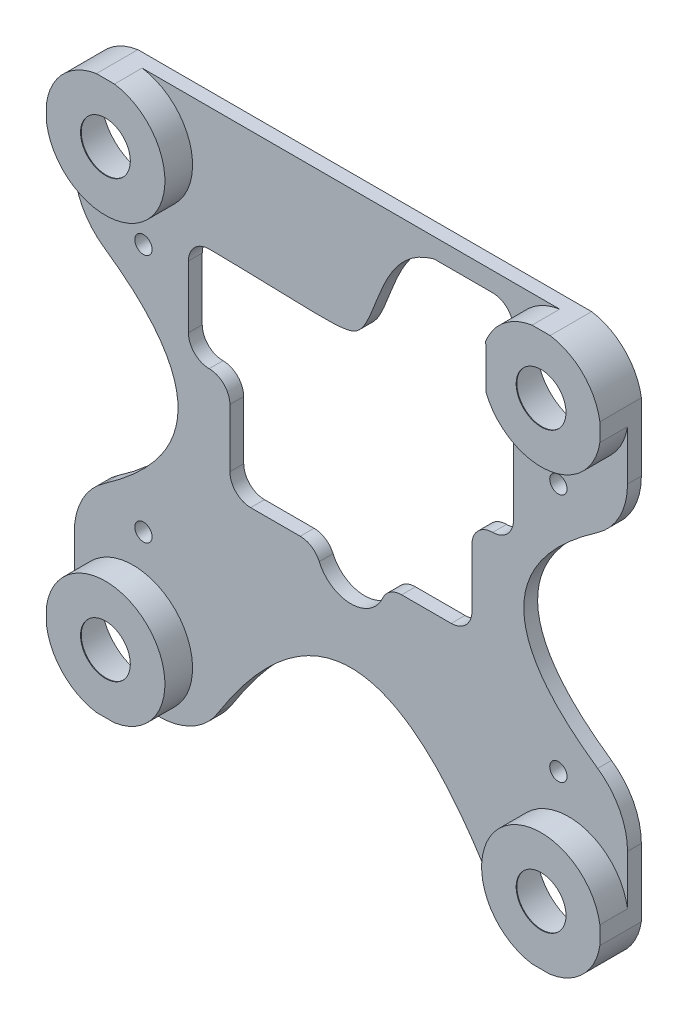
from build123d import *

# Parameters (mm, degrees)
SKETCH2_R           = 1.25
SKETCH2_R_2         = 1
BOSS_EXTRUDE1_DEPTH = 2
SKETCH2_6_R         = 3.6
BOSS_EXTRUDE2_DEPTH = 6
SKETCH2_7_R         = 6.6
SKETCH2_7_R_2       = 3.6
CUT_EXTRUDE1_DEPTH  = 5.9
FILLET1_START       = -1
FILLET1_DEPTH       = 7
FILLET1_2_DEPTH     = 2
FILLET1_START_2     = 1.81644
FILLET1_3_DEPTH     = 4.18356
FILLET2_START       = -1
FILLET2_DEPTH       = 7
FILLET3_R           = 1


with BuildPart() as part:
    # Sketch2 → Boss-Extrude1 (new body)
    # profile 1 of 9: a face of its own
    with BuildSketch(Plane.XY):
        with BuildLine():
            Line((55.869745962, 39.84949243), (43.365744361, 39.84949243))
            ThreePointArc((43.365744361, 39.84949243), (38.369745962, 35.04949243), (33.373747564, 39.84949243))
            Line((33.373747564, 39.84949243), (20.869745962, 39.84949243))
            Line((20.869745962, 39.84949243), (20.869745962, 54.24949243))
            Line((20.869745962, 54.24949243), (20.591198677, 54.24949243))
            ThreePointArc((20.591198677, 54.24949243), (15.880795925, 53.206833158), (14.869745962, 57.924121619))
            Line((14.869745962, 57.924121619), (14.869745962, 69.24949243))
            Line((14.869745962, 69.24949243), (14.869745962, 75.393545662))
            ThreePointArc((14.869745962, 75.393545662), (5.912389161, 70.002945294), (-1.630254038, 77.241822747))
            Line((-1.630254038, 77.241822747), (-1.630254038, 64.54949243))
            add(Edge.make_bspline(
                [(-1.630254038, 64.54949243), (28.369745962, 47.04949243), (-1.630254038, 29.54949243)],
                knots=[0, 0, 0, 1, 1, 1], degree=2))
            Line((-1.630254038, 29.54949243), (-1.630254038, 16.857162113))
            ThreePointArc((-1.630254038, 16.857162113), (7.525489815, 24.124455987), (15.469745962, 15.54949243))
            ThreePointArc((15.469745962, 15.54949243), (13.396841766, 9.949758475), (8.177415645, 7.04949243))
            Line((8.177415645, 7.04949243), (16.369745962, 7.04949243))
            add(Edge.make_bspline(
                [(16.369745962, 7.04949243), (38.369745962, 47.04949243), (60.369745962, 7.04949243)],
                knots=[0, 0, 0, 1, 1, 1], degree=2))
            Line((60.369745962, 7.04949243), (68.562076279, 7.04949243))
            ThreePointArc((68.562076279, 7.04949243), (63.788627644, 21.630610748), (78.369745962, 16.857162113))
            Line((78.369745962, 16.857162113), (78.369745962, 29.54949243))
            add(Edge.make_bspline(
                [(78.369745962, 64.54949243), (48.369745962, 47.04949243), (78.369745962, 29.54949243)],
                knots=[0, 0, 0, 1, 1, 1], degree=2))
            Line((78.369745962, 64.54949243), (78.369745962, 77.241822747))
            ThreePointArc((78.369745962, 77.241822747), (70.827102764, 70.002945294), (61.869745962, 75.393545662))
            Line((61.869745962, 75.393545662), (61.869745962, 57.924121619))
            ThreePointArc((61.869745962, 57.924121619), (62.280525574, 57.035978122), (62.421340097, 56.067623833))
            ThreePointArc((62.421340097, 56.067623833), (59.967817965, 52.802018278), (56.148293247, 54.24949243))
            Line((56.148293247, 54.24949243), (55.869745962, 54.24949243))
            Line((55.869745962, 54.24949243), (55.869745962, 39.84949243))
        make_face()
        with Locations((8.369745962, 29.04949243)):
            Circle(SKETCH2_R, mode=Mode.SUBTRACT)
        with Locations((68.369745962, 29.04949243)):
            Circle(SKETCH2_R, mode=Mode.SUBTRACT)
        with Locations((8.369745962, 65.04949243)):
            Circle(SKETCH2_R, mode=Mode.SUBTRACT)
        with Locations((68.369745962, 65.04949243)):
            Circle(SKETCH2_R, mode=Mode.SUBTRACT)
    # profile 2 of 9: a face of its own
    with BuildSketch(Plane.XY):
        with BuildLine():
            Line((61.869745962, 54.24949243), (56.148293247, 54.24949243))
            ThreePointArc((56.148293247, 54.24949243), (59.967817965, 52.802018278), (62.421340097, 56.067623833))
            ThreePointArc((62.421340097, 56.067623833), (62.280525574, 57.035978122), (61.869745962, 57.924121619))
            Line((61.869745962, 57.924121619), (61.869745962, 54.24949243))
        make_face()
    # profile 3 of 9: a face of its own
    with BuildSketch(Plane.XY):
        with BuildLine():
            ThreePointArc((14.869745962, 57.924121619), (15.880795925, 53.206833158), (20.591198677, 54.24949243))
            Line((20.591198677, 54.24949243), (14.869745962, 54.24949243))
            Line((14.869745962, 54.24949243), (14.869745962, 57.924121619))
        make_face()
    # profile 4 of 9: a face of its own
    with BuildSketch(Plane.XY):
        with BuildLine():
            Line((14.869745962, 75.393545662), (14.869745962, 69.24949243))
            add(Edge.make_bspline(
                [(50.380995799, 84.24949243), (42.514243304, 82.091935647), (42.394780295, 71.029237655), (36.64887418, 68.347737451), (26.581571934, 69.24949243), (14.869745962, 69.24949243)],
                knots=[0, 0, 0, 0, 0.584084088, 0.684084088, 1, 1, 1, 1], degree=3))
            Line((50.380995799, 84.24949243), (20.591198677, 84.24949243))
            ThreePointArc((20.591198677, 84.24949243), (20.983757383, 83.377838895), (21.118151828, 82.431361027))
            ThreePointArc((21.118151828, 82.431361027), (19.041016525, 79.299264446), (15.347546538, 79.994102206))
            ThreePointArc((15.347546538, 79.994102206), (15.439141651, 79.274376922), (15.469745962, 78.54949243))
            ThreePointArc((15.469745962, 78.54949243), (15.318414496, 76.94325459), (14.869745962, 75.393545662))
        make_face()
    # profile 5 of 9: a face of its own
    with BuildSketch(Plane.XY):
        with BuildLine():
            Line((61.869745962, 84.24949243), (61.869745962, 81.705439198))
            ThreePointArc((61.869745962, 81.705439198), (62.115152293, 82.26786264), (62.400038731, 82.811355155))
            ThreePointArc((62.400038731, 82.811355155), (59.783560956, 85.744821357), (56.148293247, 84.24949243))
            Line((56.148293247, 84.24949243), (61.869745962, 84.24949243))
        make_face()
    # profile 6 of 9: a face of its own
    with BuildSketch(Plane.XY):
        with BuildLine():
            Line((50.380995799, 84.24949243), (56.148293247, 84.24949243))
            ThreePointArc((56.148293247, 84.24949243), (59.783560956, 85.744821357), (62.400038731, 82.811355155))
            ThreePointArc((62.400038731, 82.811355155), (64.996242267, 85.635320662), (68.562076279, 87.04949243))
            Line((68.562076279, 87.04949243), (8.177415645, 87.04949243))
            ThreePointArc((8.177415645, 87.04949243), (11.743249657, 85.635320662), (14.339453193, 82.811355155))
            ThreePointArc((14.339453193, 82.811355155), (16.955930969, 85.744821357), (20.591198677, 84.24949243))
            Line((20.591198677, 84.24949243), (50.380995799, 84.24949243))
        make_face()
    # profile 7 of 9: a face of its own
    with BuildSketch(Plane.XY):
        with BuildLine():
            ThreePointArc((21.118151828, 82.431361027), (20.983757383, 83.377838895), (20.591198677, 84.24949243))
            Line((20.591198677, 84.24949243), (14.869745962, 84.24949243))
            Line((14.869745962, 84.24949243), (14.869745962, 81.705439198))
            ThreePointArc((14.869745962, 81.705439198), (15.152960708, 80.862143177), (15.347546538, 79.994102206))
            ThreePointArc((15.347546538, 79.994102206), (19.041016525, 79.299264446), (21.118151828, 82.431361027))
        make_face()
        with Locations((17.718151828, 82.431361027)):
            Circle(SKETCH2_R_2, mode=Mode.SUBTRACT)
    # profile 8 of 9: a face of its own
    with BuildSketch(Plane.XY):
        with BuildLine():
            Line((14.869745962, 84.24949243), (20.591198677, 84.24949243))
            ThreePointArc((20.591198677, 84.24949243), (16.955930969, 85.744821357), (14.339453193, 82.811355155))
            ThreePointArc((14.339453193, 82.811355155), (14.624339632, 82.26786264), (14.869745962, 81.705439198))
            Line((14.869745962, 81.705439198), (14.869745962, 84.24949243))
        make_face()
    # profile 9 of 9: a face of its own
    with BuildSketch(Plane.XY):
        with Locations((17.718151828, 82.431361027)):
            Circle(SKETCH2_R_2)
    extrude(amount=BOSS_EXTRUDE1_DEPTH)

    # Sketch2<6> → Boss-Extrude2 (add)
    # profile 1 of 4: a face of its own
    with BuildSketch(Plane.XY):
        with BuildLine():
            Line((61.869745962, 81.705439198), (61.869745962, 75.393545662))
            ThreePointArc((61.869745962, 75.393545662), (70.827102764, 70.002945294), (78.369745962, 77.241822747))
            Line((78.369745962, 77.241822747), (78.369745962, 79.857162113))
            ThreePointArc((78.369745962, 79.857162113), (75.95086428, 84.630610748), (71.177415645, 87.04949243))
            Line((71.177415645, 87.04949243), (68.562076279, 87.04949243))
            ThreePointArc((68.562076279, 87.04949243), (64.503378013, 85.269767352), (61.869745962, 81.705439198))
        make_face()
        with Locations((69.869745962, 78.54949243)):
            Circle(SKETCH2_6_R, mode=Mode.SUBTRACT)
    # profile 2 of 4: a face of its own
    with BuildSketch(Plane.XY):
        with BuildLine():
            ThreePointArc((-1.630254038, 77.241822747), (12.95086428, 72.468374112), (8.177415645, 87.04949243))
            Line((8.177415645, 87.04949243), (5.562076279, 87.04949243))
            ThreePointArc((5.562076279, 87.04949243), (0.788627644, 84.630610748), (-1.630254038, 79.857162113))
            Line((-1.630254038, 79.857162113), (-1.630254038, 77.241822747))
        make_face()
        with Locations((6.869745962, 78.54949243)):
            Circle(SKETCH2_6_R, mode=Mode.SUBTRACT)
    # profile 3 of 4: a face of its own
    with BuildSketch(Plane.XY):
        with BuildLine():
            Line((78.369745962, 14.241822747), (78.369745962, 16.857162113))
            ThreePointArc((78.369745962, 16.857162113), (63.788627644, 21.630610748), (68.562076279, 7.04949243))
            Line((68.562076279, 7.04949243), (71.177415645, 7.04949243))
            ThreePointArc((71.177415645, 7.04949243), (75.95086428, 9.468374112), (78.369745962, 14.241822747))
        make_face()
        with Locations((69.869745962, 15.54949243)):
            Circle(SKETCH2_6_R, mode=Mode.SUBTRACT)
    # profile 4 of 4: a face of its own
    with BuildSketch(Plane.XY):
        with BuildLine():
            ThreePointArc((8.177415645, 7.04949243), (12.95086428, 21.630610748), (-1.630254038, 16.857162113))
            Line((-1.630254038, 16.857162113), (-1.630254038, 14.241822747))
            ThreePointArc((-1.630254038, 14.241822747), (0.788627644, 9.468374112), (5.562076279, 7.04949243))
            Line((5.562076279, 7.04949243), (8.177415645, 7.04949243))
        make_face()
        with Locations((6.869745962, 15.54949243)):
            Circle(SKETCH2_6_R, mode=Mode.SUBTRACT)
    extrude(amount=BOSS_EXTRUDE2_DEPTH)

    # Sketch2<7> → Cut-Extrude1 (cut)
    # profile 1 of 4: a face of its own
    with BuildSketch(Plane.XY):
        with Locations((6.869745962, 15.54949243)):
            Circle(SKETCH2_7_R)
        with Locations((6.869745962, 15.54949243)):
            Circle(SKETCH2_7_R_2, mode=Mode.SUBTRACT)
    # profile 2 of 4: a face of its own
    with BuildSketch(Plane.XY):
        with Locations((69.869745962, 15.54949243)):
            Circle(SKETCH2_7_R)
        with Locations((69.869745962, 15.54949243)):
            Circle(SKETCH2_7_R_2, mode=Mode.SUBTRACT)
    # profile 3 of 4: a face of its own
    with BuildSketch(Plane.XY):
        with Locations((69.869745962, 78.54949243)):
            Circle(SKETCH2_7_R)
        with Locations((69.869745962, 78.54949243)):
            Circle(SKETCH2_7_R_2, mode=Mode.SUBTRACT)
    # profile 4 of 4: a face of its own
    with BuildSketch(Plane.XY):
        with Locations((6.869745962, 78.54949243)):
            Circle(SKETCH2_7_R)
        with Locations((6.869745962, 78.54949243)):
            Circle(SKETCH2_7_R_2, mode=Mode.SUBTRACT)
    extrude(amount=CUT_EXTRUDE1_DEPTH, mode=Mode.SUBTRACT)

    # Fillet1: read off the stored shape, not the designer's step
    # Fillet1 outline → Fillet1 (cut)
    with BuildSketch(Plane.XY.offset(FILLET1_START)):
        with BuildLine():
            Line((20.869745962, 54.24949243), (17.869745962, 54.24949243))
            ThreePointArc((17.869745962, 54.24949243), (19.991066306, 53.370812774), (20.869745962, 51.24949243))
            Line((20.869745962, 51.24949243), (20.869745962, 54.24949243))
        make_face()
        with BuildLine():
            Line((33.373747564, 39.84949243), (31.03762485, 39.84949243))
            ThreePointArc((31.03762485, 39.84949243), (32.680792523, 39.35947251), (33.787170267, 38.04949243))
            ThreePointArc((33.787170267, 38.04949243), (33.496628848, 38.9302384), (33.373747564, 39.84949243))
        make_face()
        with BuildLine():
            ThreePointArc((55.869745962, 51.24949243), (56.748425619, 53.370812773), (58.869745962, 54.24949243))
            Line((58.869745962, 54.24949243), (55.869745962, 54.24949243))
            Line((55.869745962, 54.24949243), (55.869745962, 51.24949243))
        make_face()
        with BuildLine():
            ThreePointArc((43.365744361, 39.84949243), (43.242863077, 38.9302384), (42.952321657, 38.04949243))
            ThreePointArc((42.952321657, 38.04949243), (44.058699401, 39.35947251), (45.701867074, 39.84949243))
            Line((45.701867074, 39.84949243), (43.365744361, 39.84949243))
        make_face()
    extrude(amount=FILLET1_DEPTH, mode=Mode.SUBTRACT)

    # Fillet1 2 outline → Fillet1 2 (add)
    with BuildSketch(Plane.XY):
        with BuildLine():
            Line((14.869745962, 69.24949243), (14.869745962, 66.234671273))
            ThreePointArc((14.869745962, 66.234671273), (15.758805302, 68.366320759), (17.899032314, 69.234528322))
            add(Edge.make_bspline(
                [(17.899032314, 69.234528322), (16.921620346, 69.244070387), (15.911772673, 69.24949243), (14.869745962, 69.24949243)],
                knots=[0.971892272, 0.971892272, 0.971892272, 0.971892272, 1, 1, 1, 1], degree=3))
        make_face()
        with BuildLine():
            ThreePointArc((17.869745962, 54.24949243), (15.748425619, 55.128172087), (14.869745962, 57.24949243))
            Line((14.869745962, 57.24949243), (14.869745962, 54.24949243))
            Line((14.869745962, 54.24949243), (17.869745962, 54.24949243))
        make_face()
        with BuildLine():
            Line((61.869745962, 84.24949243), (58.869745962, 84.24949243))
            ThreePointArc((58.869745962, 84.24949243), (60.991066306, 83.370812774), (61.869745962, 81.24949243))
            Line((61.869745962, 81.24949243), (61.869745962, 84.24949243))
        make_face()
        with BuildLine():
            ThreePointArc((23.869745962, 39.84949243), (21.748425619, 40.728172087), (20.869745962, 42.84949243))
            Line((20.869745962, 42.84949243), (20.869745962, 39.84949243))
            Line((20.869745962, 39.84949243), (23.869745962, 39.84949243))
        make_face()
        with BuildLine():
            Line((61.869745962, 54.24949243), (61.869745962, 57.24949243))
            ThreePointArc((61.869745962, 57.24949243), (60.991066305, 55.128172087), (58.869745962, 54.24949243))
            Line((58.869745962, 54.24949243), (61.869745962, 54.24949243))
        make_face()
        with BuildLine():
            Line((55.869745962, 39.84949243), (55.869745962, 42.84949243))
            ThreePointArc((55.869745962, 42.84949243), (54.991066305, 40.728172086), (52.869745962, 39.84949243))
            Line((52.869745962, 39.84949243), (55.869745962, 39.84949243))
        make_face()
    extrude(amount=FILLET1_2_DEPTH)

    # Fillet1 3 outline → Fillet1 3 (add)
    with BuildSketch(Plane.XY.offset(FILLET1_START_2)):
        with BuildLine():
            ThreePointArc((61.869745963, 81.705439198), (61.856919019, 81.672728633), (61.844225823, 81.639965936))
            ThreePointArc((61.844225823, 81.639965936), (61.863359129, 81.445145718), (61.869745962, 81.24949243))
            Line((61.869745962, 81.24949243), (61.869745963, 81.705439198))
        make_face()
    extrude(amount=FILLET1_3_DEPTH)

    # Fillet2: read off the stored shape, not the designer's step
    # Fillet2 outline → Fillet2 (cut)
    with BuildSketch(Plane.XY.offset(FILLET2_START)):
        with BuildLine():
            Line((60.369745962, 7.04949243), (66.091903249, 7.04949243))
            ThreePointArc((66.091903249, 7.04949243), (61.254907797, 8.297151315), (57.624896415, 11.728797432))
            add(Edge.make_bspline(
                [(57.624896415, 11.728797432), (58.997321189, 9.5448102), (60.369745962, 7.04949243)],
                knots=[0.937617056, 0.937617056, 0.937617056, 1, 1, 1], degree=2))
        make_face()
        with BuildLine():
            add(Edge.make_bspline(
                [(16.369745962, 7.04949243), (17.742170736, 9.5448102), (19.11459551, 11.728797432)],
                knots=[0, 0, 0, 0.062382944, 0.062382944, 0.062382944], degree=2))
            ThreePointArc((19.11459551, 11.728797432), (15.484584128, 8.297151315), (10.647588675, 7.04949243))
            Line((10.647588675, 7.04949243), (16.369745962, 7.04949243))
        make_face()
        with BuildLine():
            Line((-1.630254038, 29.54949243), (-1.630254038, 24.052687418))
            ThreePointArc((-1.630254038, 24.052687418), (-0.48620705, 28.697264497), (2.684165211, 32.279118693))
            add(Edge.make_bspline(
                [(2.684165211, 32.279118693), (0.709425616, 30.914305562), (-1.630254038, 29.54949243)],
                knots=[0.922010678, 0.922010678, 0.922010678, 1, 1, 1], degree=2))
        make_face()
        with BuildLine():
            add(Edge.make_bspline(
                [(-1.630254038, 64.54949243), (0.709425616, 63.184679299), (2.684165211, 61.819866167)],
                knots=[0, 0, 0, 0.077989322, 0.077989322, 0.077989322], degree=2))
            ThreePointArc((2.684165211, 61.819866167), (-0.48620705, 65.401720363), (-1.630254038, 70.046297442))
            Line((-1.630254038, 70.046297442), (-1.630254038, 64.54949243))
        make_face()
        with BuildLine():
            Line((78.369745962, 64.54949243), (78.369745962, 70.046297442))
            ThreePointArc((78.369745962, 70.046297442), (77.225698974, 65.401720363), (74.055326713, 61.819866167))
            add(Edge.make_bspline(
                [(78.369745962, 64.54949243), (76.030066308, 63.184679299), (74.055326713, 61.819866167)],
                knots=[0, 0, 0, 0.077989322, 0.077989322, 0.077989322], degree=2))
        make_face()
        with BuildLine():
            add(Edge.make_bspline(
                [(74.055326713, 32.279118693), (76.030066308, 30.914305562), (78.369745962, 29.54949243)],
                knots=[0.922010678, 0.922010678, 0.922010678, 1, 1, 1], degree=2))
            ThreePointArc((74.055326713, 32.279118693), (77.225698974, 28.697264497), (78.369745962, 24.052687418))
            Line((78.369745962, 24.052687418), (78.369745962, 29.54949243))
        make_face()
    extrude(amount=FILLET2_DEPTH, mode=Mode.SUBTRACT)

    # Fillet3
    fillet3_edges = [part.edges().sort_by_distance(p)[0] for p in [
        (0.269745962, 15.54949243, 5.9),
        (63.269745962, 15.54949243, 5.9),
        (63.269745962, 78.54949243, 5.9),
        (0.269745962, 78.54949243, 5.9),
    ]]
    fillet(fillet3_edges, radius=FILLET3_R)


solid = part.part
